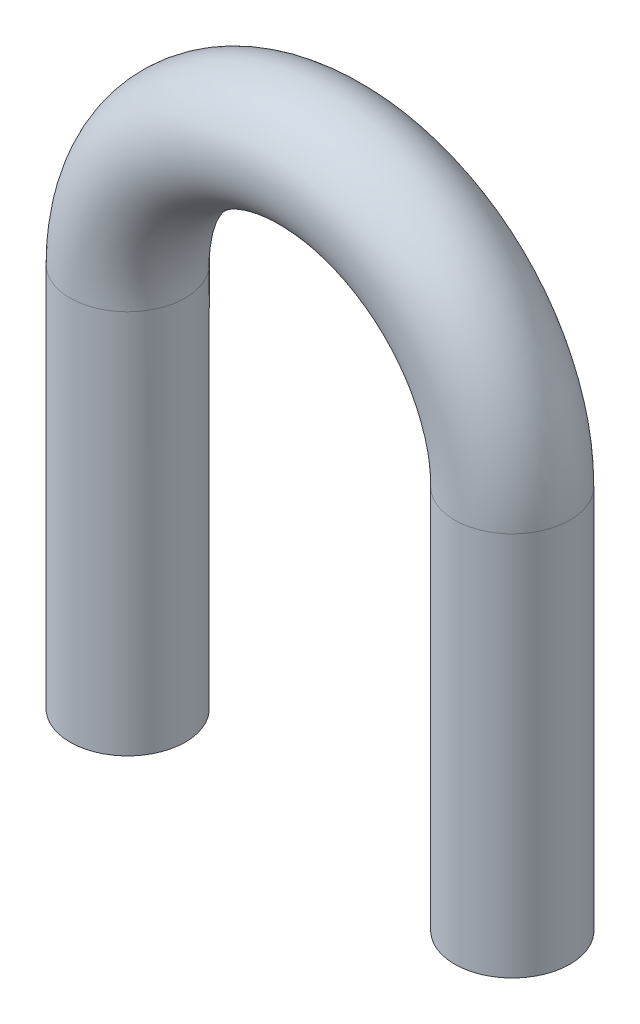
from build123d import *

# Parameters (mm, degrees)
SKETCH1_R           = 1.5
REVOLVE1_ANGLE      = 180
SKETCH2_R           = 1.5
BOSS_EXTRUDE1_DEPTH = 10


with BuildPart() as part:
    # Sketch1 → Revolve1 (revolve)
    with BuildSketch(Plane(origin=(0, 0, 0), x_dir=(1, 0, 0), z_dir=(0, 1, 0))):
        with Locations((5, 0)):
            Circle(SKETCH1_R)
    revolve(axis=Axis((0, 0, 188.267496387), (0, 0, 1)), revolution_arc=REVOLVE1_ANGLE)

    # Sketch2 → Boss-Extrude1 (add)
    with BuildSketch(Plane.XZ):
        with Locations((5, 0)):
            Circle(SKETCH2_R)
        with Locations((-5, 0)):
            Circle(SKETCH2_R)
    extrude(amount=BOSS_EXTRUDE1_DEPTH)


solid = part.part
